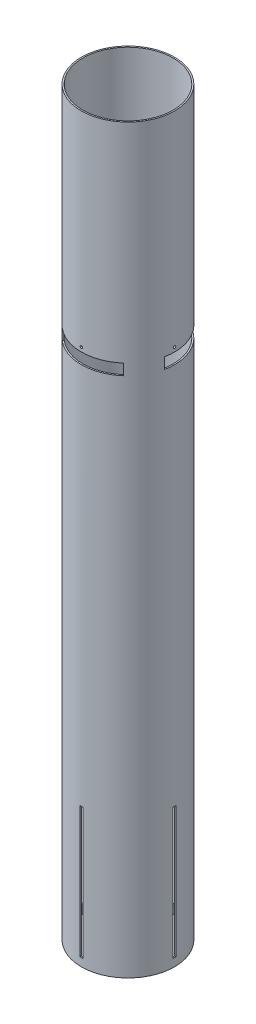
from build123d import *

# Parameters (mm, degrees)
SKETCH1_R           = 51.1048
SKETCH1_R_2         = 49.53
BOSS_EXTRUDE1_DEPTH = 812.8
CUT_EXTRUDE1_DEPTH  = 817.00688794
CIRPATTERN1_COUNT   = 4
CUT_EXTRUDE2_DEPTH  = 817.00688794
CIRPATTERN2_COUNT   = 4
SKETCH3_R           = 3.175
CUT_EXTRUDE3_DEPTH  = 817.006888053
CUT_EXTRUDE4_START  = -12.065
CUT_EXTRUDE4_DEPTH  = 12.065
CIRPATTERN3_COUNT   = 3


with BuildPart() as part:
    # Sketch1 → Boss-Extrude1 (new body)
    with BuildSketch(Plane(origin=(0, 0, 0), x_dir=(1, 0, 0), z_dir=(0, 1, 0))):
        Circle(SKETCH1_R)
        Circle(SKETCH1_R_2, mode=Mode.SUBTRACT)
    extrude(amount=BOSS_EXTRUDE1_DEPTH)

    # Sketch2 → Cut-Extrude1 (cut, through all)
    with BuildSketch(Plane(origin=(0, 0, 0), x_dir=(0, 0, -1), z_dir=(1, 0, 0))):
        Polygon((0, 8.89), (1.5875, 8.89), (1.5875, 152.4), (-1.5875, 152.4), (-1.5875, 8.89), align=None)
    cut_extrude1 = extrude(amount=-CUT_EXTRUDE1_DEPTH, mode=Mode.SUBTRACT)

    # CirPattern1: Cut-Extrude1 ×4 about axis
    cirpattern1_axis = Axis((0, 0, 0), (0, 1, 0))
    for i in range(1, CIRPATTERN1_COUNT):
        add(cut_extrude1.rotate(cirpattern1_axis, i * 360 / CIRPATTERN1_COUNT), mode=Mode.SUBTRACT)

    # Sketch2<3> → Cut-Extrude2 (cut, through all)
    with BuildSketch(Plane(origin=(0, 0, 0), x_dir=(0, 0, -1), z_dir=(1, 0, 0))):
        with BuildLine():
            ThreePointArc((0, 589.99755), (-0.956397277, 587.688602723), (1.35255, 588.645))
            ThreePointArc((1.35255, 588.645), (0.956397277, 589.601397277), (0, 589.99755))
        make_face()
    cut_extrude2 = extrude(amount=-CUT_EXTRUDE2_DEPTH, mode=Mode.SUBTRACT)

    # CirPattern2: Cut-Extrude2 ×4 about axis
    cirpattern2_axis = Axis((0, 812.8, 0), (0, -1, 0))
    for i in range(1, CIRPATTERN2_COUNT):
        add(cut_extrude2.rotate(cirpattern2_axis, i * 360 / CIRPATTERN2_COUNT), mode=Mode.SUBTRACT)

    # Sketch3 → Cut-Extrude3 (cut, through all)
    with BuildSketch(Plane(origin=(0, 0, 0), x_dir=(0.7071067811865477, 0, -0.7071067811865475), z_dir=(0.7071067811865475, 0, 0.7071067811865477))):
        with Locations((0, 127)):
            Circle(SKETCH3_R)
    extrude(amount=-CUT_EXTRUDE3_DEPTH, mode=Mode.SUBTRACT)

    # Sketch7 → Cut-Extrude4 (cut)
    with BuildSketch(Plane(origin=(0, 583.8825, 0), x_dir=(1, 0, 0), z_dir=(0, 1, 0)).offset(CUT_EXTRUDE4_START)):
        with BuildLine():
            Line((-50.122835598, -9.970051889), (-48.578294938, -9.662823649))
            ThreePointArc((-48.578294938, -9.662823649), (-42.894238249, 24.765), (-15.920896716, 46.901449314))
            Line((-15.920896716, 46.901449314), (-16.427099586, 48.392674882))
            ThreePointArc((-16.427099586, 48.392674882), (-41.142779675, 30.31455531), (-51.086898433, 1.35255))
            ThreePointArc((-51.086898433, 1.35255), (-51.1048, 0), (-51.086898433, -1.35255))
            ThreePointArc((-51.086898433, -1.35255), (-50.787970036, -5.681785166), (-50.122835598, -9.970051889))
        make_face()
    cut_extrude4 = extrude(amount=CUT_EXTRUDE4_DEPTH, mode=Mode.SUBTRACT)

    # CirPattern3: Cut-Extrude4 ×3 about axis
    cirpattern3_axis = Axis((0, 812.8, 0), (0, -1, 0))
    for i in range(1, CIRPATTERN3_COUNT):
        add(cut_extrude4.rotate(cirpattern3_axis, i * 360 / CIRPATTERN3_COUNT), mode=Mode.SUBTRACT)


solid = part.part
